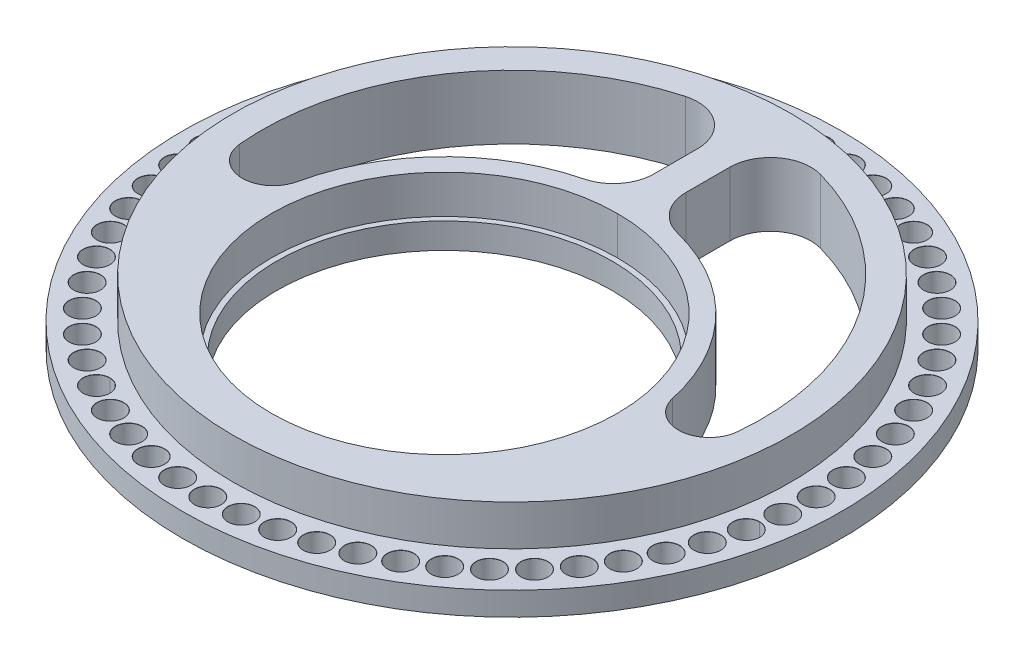
from build123d import *

# Parameters (mm, degrees)
SLOTTED_BODY_EXTRUDE_DEPTH      = 4.191
SLOTTED_BODY_EXTRUDE_DEPTH_BACK = 0.2032
SKETCH1_R                       = 61.9125
SKETCH1_R_2                     = 30.988
SKETCH5_R                       = 52.3875
BOSS_EXTRUDE3_DEPTH             = 7.62
SKETCH6_R                       = 32.512
CUT_EXTRUDE5_DEPTH              = 89.377917571
SKETCH8_R                       = 32.512
SKETCH8_R_2                     = 31.496
BOSS_EXTRUDE4_DEPTH             = 4.795000062
CIRPATTERN1_COUNT               = 60


with BuildPart() as part:
    # Sketch1 → Slotted-Body Extrude (new, two sides: drawn at the far end of the back side and taken through both)
    with BuildSketch(Plane(origin=(0, 0, 0), x_dir=(1, 0, 0), z_dir=(0, 1, 0)).offset(-SLOTTED_BODY_EXTRUDE_DEPTH_BACK)):
        Circle(SKETCH1_R)
        with Locations((0, -12.7)):
            Circle(SKETCH1_R_2, mode=Mode.SUBTRACT)
    extrude(amount=SLOTTED_BODY_EXTRUDE_DEPTH + SLOTTED_BODY_EXTRUDE_DEPTH_BACK)

    # Sketch5 → Boss-Extrude3 (add)
    with BuildSketch(Plane(origin=(0, 4.191, 0), x_dir=(1, 0, 0), z_dir=(0, 1, 0))):
        Circle(SKETCH5_R)
    extrude(amount=BOSS_EXTRUDE3_DEPTH)

    # Sketch6 → Cut-Extrude5 (cut, through all)
    with BuildSketch(Plane.XZ.offset(0.2032)):
        with Locations((0, 12.7)):
            Circle(SKETCH6_R)
        with BuildLine():
            Line((3.013951015, -37.906674687), (3.013951015, -29.674053734))
            ThreePointArc((3.013951015, -29.674053734), (4.62572071, -24.987309811), (8.779192117, -22.283230408))
            ThreePointArc((8.779192117, -22.283230408), (25.925135322, -12.375645206), (35.256203169, 5.09074497))
            ThreePointArc((35.256203169, 5.09074497), (41.313127715, 9.689980346), (46.782976949, 4.406037654))
            ThreePointArc((46.782976949, 4.406037654), (38.737451576, -26.59830719), (12.692135082, -45.243450433))
            ThreePointArc((12.692135082, -45.243450433), (6.03063496, -43.979061474), (3.013951015, -37.906674687))
        make_face()
        with BuildLine():
            Line((-3.013951015, -37.906674687), (-3.013951015, -29.674053734))
            ThreePointArc((-3.013951015, -29.674053734), (-4.62572071, -24.987309811), (-8.779192117, -22.283230408))
            ThreePointArc((-8.779192117, -22.283230408), (-25.925135322, -12.375645206), (-35.256203169, 5.09074497))
            ThreePointArc((-35.256203169, 5.09074497), (-41.313127715, 9.689980346), (-46.782976949, 4.406037654))
            ThreePointArc((-46.782976949, 4.406037654), (-38.737451576, -26.59830719), (-12.692135082, -45.243450433))
            ThreePointArc((-12.692135082, -45.243450433), (-6.03063496, -43.979061474), (-3.013951015, -37.906674687))
        make_face()
    extrude(amount=-CUT_EXTRUDE5_DEPTH, mode=Mode.SUBTRACT)

    # Sketch10 → Ø5.0mm Dowel Hole2 (revolve, cut)
    with BuildSketch(Plane(origin=(0, 4.191, -57.15), x_dir=(0, 0, 1), z_dir=(1, 0, 0))):
        Polygon((0, 0), (0, 4.3942), (2.5, 4.3942), (2.5, 0.025), (2.525, 0), align=None)
    f_5_0mm_dowel_hole2 = revolve(axis=Axis((0, 10.541, -57.15), (0, -1, 0)), mode=Mode.SUBTRACT)

    # CirPattern1: Ø5.0mm Dowel Hole2 ×60 about axis
    cirpattern1_axis = Axis((0, 11.811, 0), (0, -1, 0))
    for i in range(1, CIRPATTERN1_COUNT):
        add(f_5_0mm_dowel_hole2.rotate(cirpattern1_axis, i * 360 / CIRPATTERN1_COUNT), mode=Mode.SUBTRACT)


with BuildPart() as body_2:
    # Sketch8 → Boss-Extrude4 (new body)
    with BuildSketch(Plane.XZ.offset(0.2032)):
        with Locations((0, 12.7)):
            Circle(SKETCH8_R)
        with Locations((0, 12.7)):
            Circle(SKETCH8_R_2, mode=Mode.SUBTRACT)
    extrude(amount=-BOSS_EXTRUDE4_DEPTH)


solid = Compound([part.part, body_2.part])
